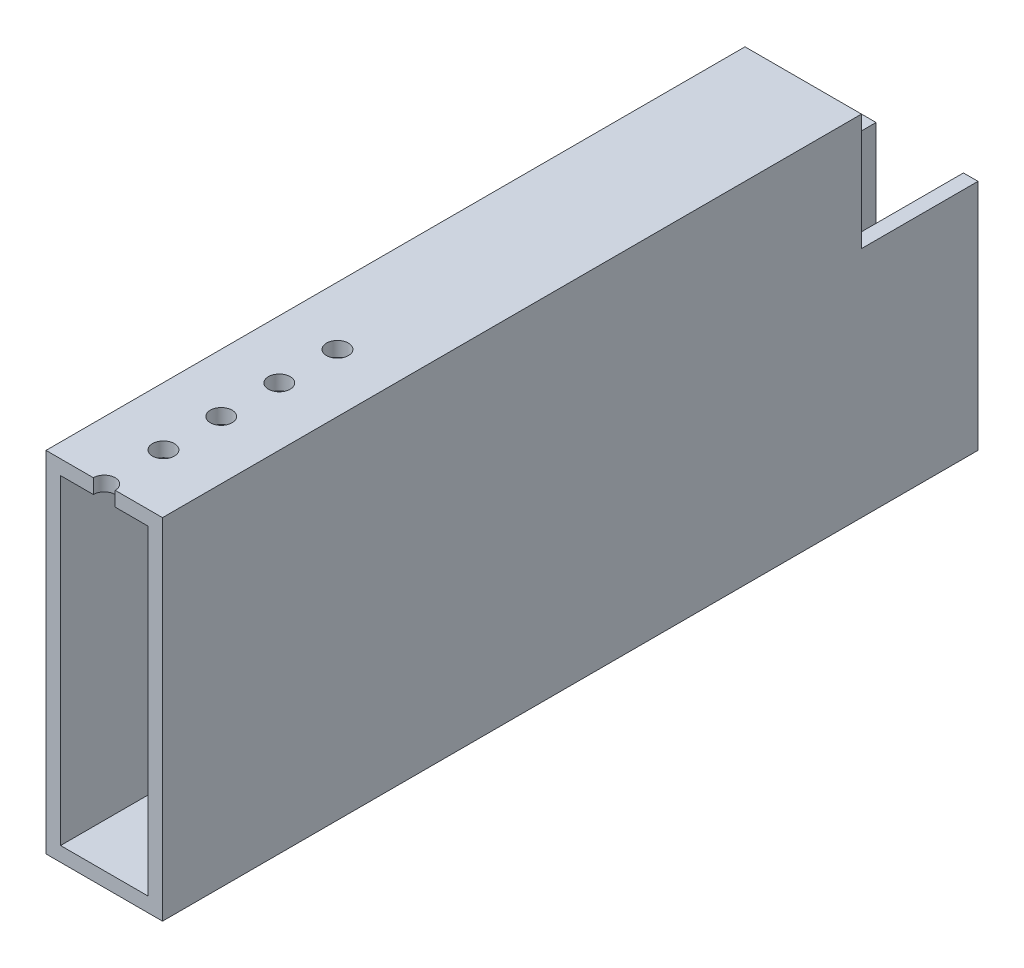
from build123d import *

# Parameters (mm, degrees)
SKETCH1_W           = 25.4
SKETCH1_H           = 76.2
BOSS_EXTRUDE1_DEPTH = 88.9
SHELL1_T            = -3.175
SKETCH2_W           = 25.4
SKETCH2_H           = 25.4
CUT_EXTRUDE1_DEPTH  = 100.9999
CUT_EXTRUDE2_REACH  = 119.775
SKETCH3_R           = 2.38125


with BuildPart() as part:
    # Sketch1 → Boss-Extrude1 (new, symmetric)
    with BuildSketch(Plane.XY):
        Rectangle(SKETCH1_W, SKETCH1_H)
    extrude(amount=BOSS_EXTRUDE1_DEPTH, both=True)

    # Shell1
    shell1_openings = [part.faces().sort_by_distance(p)[0] for p in [
        (0, 0, -88.9),
        (0, 0, 88.9),
    ]]
    offset(amount=SHELL1_T, openings=shell1_openings, kind=Kind.INTERSECTION)

    # Sketch2 → Cut-Extrude1 (cut, through all)
    with BuildSketch(Plane.ZY.offset(12.7)):
        with Locations((-76.2, 25.4)):
            Rectangle(SKETCH2_W, SKETCH2_H)
    extrude(amount=-CUT_EXTRUDE1_DEPTH, mode=Mode.SUBTRACT)

    # Sketch3 → Cut-Extrude2 (cut, up to next)
    with BuildSketch(Plane(origin=(0, 38.1, 0), x_dir=(1, 0, 0), z_dir=(0, 1, 0)), mode=Mode.PRIVATE) as cut_extrude2_sk1:
        with Locations((0, -88.9)):
            Circle(SKETCH3_R)
    cut_extrude2_tool1 = extrude(cut_extrude2_sk1.sketch, amount=-CUT_EXTRUDE2_REACH, mode=Mode.PRIVATE) & part.part
    # Sketch3 → Cut-Extrude2 (cut, up to next)
    with BuildSketch(Plane(origin=(0, 38.1, 0), x_dir=(1, 0, 0), z_dir=(0, 1, 0)), mode=Mode.PRIVATE) as cut_extrude2_sk2:
        with Locations((0, -75.995900078)):
            Circle(SKETCH3_R)
    cut_extrude2_tool2 = extrude(cut_extrude2_sk2.sketch, amount=-CUT_EXTRUDE2_REACH, mode=Mode.PRIVATE) & part.part
    # Sketch3 → Cut-Extrude2 (cut, up to next)
    with BuildSketch(Plane(origin=(0, 38.1, 0), x_dir=(1, 0, 0), z_dir=(0, 1, 0)), mode=Mode.PRIVATE) as cut_extrude2_sk3:
        with Locations((0, -63.397337518)):
            Circle(SKETCH3_R)
    cut_extrude2_tool3 = extrude(cut_extrude2_sk3.sketch, amount=-CUT_EXTRUDE2_REACH, mode=Mode.PRIVATE) & part.part
    # Sketch3 → Cut-Extrude2 (cut, up to next)
    with BuildSketch(Plane(origin=(0, 38.1, 0), x_dir=(1, 0, 0), z_dir=(0, 1, 0)), mode=Mode.PRIVATE) as cut_extrude2_sk4:
        with Locations((0, -50.731481722)):
            Circle(SKETCH3_R)
    cut_extrude2_tool4 = extrude(cut_extrude2_sk4.sketch, amount=-CUT_EXTRUDE2_REACH, mode=Mode.PRIVATE) & part.part
    # Sketch3 → Cut-Extrude2 (cut, up to next)
    with BuildSketch(Plane(origin=(0, 38.1, 0), x_dir=(1, 0, 0), z_dir=(0, 1, 0)), mode=Mode.PRIVATE) as cut_extrude2_sk5:
        with Locations((0, -38.048590908)):
            Circle(SKETCH3_R)
    cut_extrude2_tool5 = extrude(cut_extrude2_sk5.sketch, amount=-CUT_EXTRUDE2_REACH, mode=Mode.PRIVATE) & part.part
    add(cut_extrude2_tool1.solids().sort_by_distance((0, 38.1, 88.9))[0], mode=Mode.SUBTRACT)
    add(cut_extrude2_tool2.solids().sort_by_distance((0, 38.1, 75.9959))[0], mode=Mode.SUBTRACT)
    add(cut_extrude2_tool3.solids().sort_by_distance((0, 38.1, 63.397338))[0], mode=Mode.SUBTRACT)
    add(cut_extrude2_tool4.solids().sort_by_distance((0, 38.1, 50.731482))[0], mode=Mode.SUBTRACT)
    add(cut_extrude2_tool5.solids().sort_by_distance((0, 38.1, 38.048591))[0], mode=Mode.SUBTRACT)


solid = part.part
